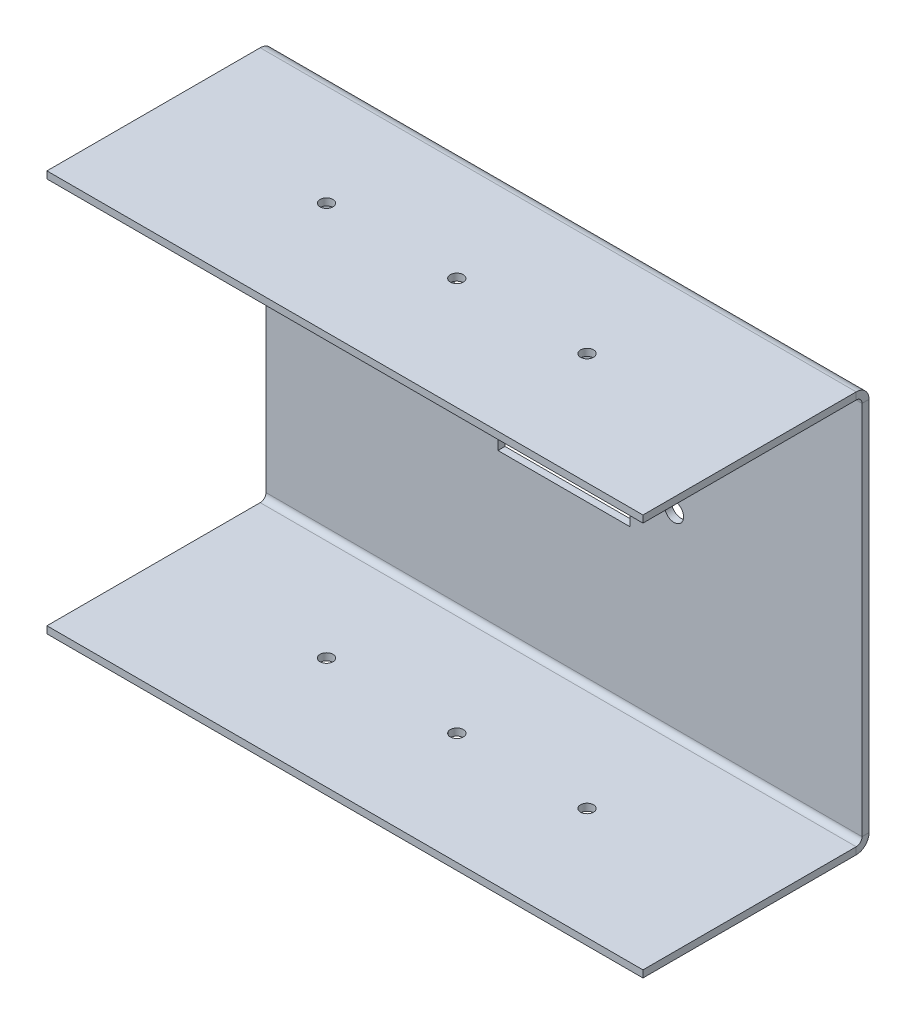
from build123d import *

# Parameters (mm, degrees)
SKETCH1_W                    = 135.38
SKETCH1_H                    = 188.37
SKETCH1_R                    = 1.4732
SKETCH1_R_2                  = 2.155
SKETCH1_W_2                  = 30
SKETCH1_H_2                  = 20
BASE_FLANGE1_DEPTH           = 1.6002
SKETCHED_BEND1_OUTLINE_W     = 135.38
SKETCHED_BEND1_OUTLINE_H     = 1.6002
SKETCHED_BEND1_DEPTH         = 137.314310973
SKETCHED_START               = 164.4432001
SKETCHED_BEND1_2_OUTLINE_W   = 135.38
SKETCHED_BEND1_2_OUTLINE_H   = 1.6002
SKETCHED_BEND1_2_DEPTH       = 23.9267999
SKETCHED_START_2             = 139.935207433
SKETCHED_BEND1_3_OUTLINE_W   = 135.38
SKETCHED_BEND1_3_OUTLINE_H   = 1.6002
SKETCHED_BEND1_3_DEPTH       = 21.561592467
SKETCHED_START_3             = 138.466703893
SKETCHED_BEND1_4_OUTLINE_W   = 135.38
SKETCHED_BEND1_4_OUTLINE_H   = 87.881185133
SKETCHED_BEND1_4_OUTLINE_R   = 2.155
SKETCHED_BEND1_4_OUTLINE_W_2 = 30
SKETCHED_BEND1_4_OUTLINE_H_2 = 20
SKETCHED_BEND1_4_DEPTH       = 0.14770354
SKETCHED_START_4             = 137.014207433
SKETCHED_BEND1_5_OUTLINE_W   = 135.38
SKETCHED_BEND1_5_OUTLINE_H   = 87.881185133
SKETCHED_BEND1_5_OUTLINE_R   = 2.155
SKETCHED_BEND1_5_OUTLINE_W_2 = 30
SKETCHED_BEND1_5_OUTLINE_H_2 = 20
SKETCHED_BEND1_5_DEPTH       = 2.921
SKETCHED_START_5             = 137.314310973
SKETCHED_BEND1_6_OUTLINE_W   = 135.38
SKETCHED_BEND1_6_OUTLINE_H   = 1.6002
SKETCHED_BEND1_6_DEPTH       = 27.128889127
SKETCHED_BEND1_7_DEPTH       = 135.38
SKETCHED_START_6             = 87
SKETCHED_BEND1_8_OUTLINE_R   = 1.4732
SKETCHED_BEND1_8_DEPTH       = 2.481385133


with BuildPart() as part:
    # Base-Flange1: sheet metal written as solids
    # Sketch1 → Base-Flange1 (new body)
    with BuildSketch(Plane(origin=(0, 0, 0), x_dir=(1, 0, 0), z_dir=(0, 1, 0))):
        with Locations((67.69, -94.185)):
            Rectangle(SKETCH1_W, SKETCH1_H)
        with Locations(Location((38.1, -25.4, 0), (0, 0, 270))):
            Circle(SKETCH1_R, mode=Mode.SUBTRACT)
        with Locations(Location((97.28, -25.4, 0), (0, 0, 270))):
            Circle(SKETCH1_R, mode=Mode.SUBTRACT)
        with Locations(Location((97.28, -162.97, 0), (0, 0, 90))):
            Circle(SKETCH1_R, mode=Mode.SUBTRACT)
        with Locations(Location((38.1, -162.97, 0), (0, 0, 90))):
            Circle(SKETCH1_R, mode=Mode.SUBTRACT)
        with Locations(Location((67.69, -25.4, 0), (0, 0, 270))):
            Circle(SKETCH1_R, mode=Mode.SUBTRACT)
        with Locations(Location((67.69, -162.97, 0), (0, 0, 270))):
            Circle(SKETCH1_R, mode=Mode.SUBTRACT)
        with Locations(Location((42.69, -94.185, 0), (0, 0, 270))):
            Circle(SKETCH1_R_2, mode=Mode.SUBTRACT)
        with Locations(Location((92.69, -94.185, 0), (0, 0, 270))):
            Circle(SKETCH1_R_2, mode=Mode.SUBTRACT)
        with Locations(Location((42.69, -74.185, 0), (0, 0, 270))):
            Circle(SKETCH1_R_2, mode=Mode.SUBTRACT)
        with Locations(Location((92.69, -74.185, 0), (0, 0, 270))):
            Circle(SKETCH1_R_2, mode=Mode.SUBTRACT)
        with Locations((67.69, -92.185)):
            Rectangle(SKETCH1_W_2, SKETCH1_H_2, mode=Mode.SUBTRACT)
    extrude(amount=-BASE_FLANGE1_DEPTH)

    # Sketched Bend1: read off the stored shape, not the designer's step
    # Sketched Bend1 outline → Sketched Bend1 (cut)
    with BuildSketch(Plane.XY):
        with Locations((67.69, -0.8001)):
            Rectangle(SKETCHED_BEND1_OUTLINE_W, SKETCHED_BEND1_OUTLINE_H)
    extrude(amount=SKETCHED_BEND1_DEPTH, mode=Mode.SUBTRACT)

    # Sketched Bend1 4 outline → Sketched Bend1 4 (add)
    with BuildSketch(Plane.XY.offset(SKETCHED_START_3)):
        with Locations((67.69, 43.940592567)):
            Rectangle(SKETCHED_BEND1_4_OUTLINE_W, SKETCHED_BEND1_4_OUTLINE_H)
        with Locations((42.69, 43.940592567)):
            Circle(SKETCHED_BEND1_4_OUTLINE_R, mode=Mode.SUBTRACT)
        with Locations((42.69, 63.940592567)):
            Circle(SKETCHED_BEND1_4_OUTLINE_R, mode=Mode.SUBTRACT)
        with Locations((67.69, 45.940592567)):
            Rectangle(SKETCHED_BEND1_4_OUTLINE_W_2, SKETCHED_BEND1_4_OUTLINE_H_2, mode=Mode.SUBTRACT)
        with Locations((92.69, 43.940592567)):
            Circle(SKETCHED_BEND1_4_OUTLINE_R, mode=Mode.SUBTRACT)
        with Locations((92.69, 63.940592567)):
            Circle(SKETCHED_BEND1_4_OUTLINE_R, mode=Mode.SUBTRACT)
    extrude(amount=SKETCHED_BEND1_4_DEPTH)



with BuildPart() as body_2:
    # Sketched Bend1 2 outline → Sketched Bend1 2 (new body)
    with BuildSketch(Plane.XY.offset(SKETCHED_START)):
        with Locations((67.69, 88.681285133)):
            Rectangle(SKETCHED_BEND1_2_OUTLINE_W, SKETCHED_BEND1_2_OUTLINE_H)
    extrude(amount=SKETCHED_BEND1_2_DEPTH)


with BuildPart() as body_3:
    # Sketched Bend1 3 outline → Sketched Bend1 3 (new body)
    with BuildSketch(Plane.XY.offset(SKETCHED_START_2)):
        with Locations((67.69, 88.681285133)):
            Rectangle(SKETCHED_BEND1_3_OUTLINE_W, SKETCHED_BEND1_3_OUTLINE_H)
    extrude(amount=SKETCHED_BEND1_3_DEPTH)


with BuildPart() as part_1:
    add(part.part)

    add(body_3.part)  # Sketched Bend1 5 merges body 3
    # Sketched Bend1 5 outline → Sketched Bend1 5 (add)
    with BuildSketch(Plane.XY.offset(SKETCHED_START_4)):
        with Locations((67.69, 43.940592567)):
            Rectangle(SKETCHED_BEND1_5_OUTLINE_W, SKETCHED_BEND1_5_OUTLINE_H)
        with Locations((42.69, 43.940592567)):
            Circle(SKETCHED_BEND1_5_OUTLINE_R, mode=Mode.SUBTRACT)
        with Locations((92.69, 43.940592567)):
            Circle(SKETCHED_BEND1_5_OUTLINE_R, mode=Mode.SUBTRACT)
        with Locations((42.69, 63.940592567)):
            Circle(SKETCHED_BEND1_5_OUTLINE_R, mode=Mode.SUBTRACT)
        with Locations((67.69, 45.940592567)):
            Rectangle(SKETCHED_BEND1_5_OUTLINE_W_2, SKETCHED_BEND1_5_OUTLINE_H_2, mode=Mode.SUBTRACT)
        with Locations((92.69, 63.940592567)):
            Circle(SKETCHED_BEND1_5_OUTLINE_R, mode=Mode.SUBTRACT)
    extrude(amount=SKETCHED_BEND1_5_DEPTH)


    add(body_2.part)  # Sketched Bend1 6 merges body 2
    # Sketched Bend1 6 outline → Sketched Bend1 6 (add)
    with BuildSketch(Plane.XY.offset(SKETCHED_START_5)):
        with Locations((67.69, 88.681285133)):
            Rectangle(SKETCHED_BEND1_6_OUTLINE_W, SKETCHED_BEND1_6_OUTLINE_H)
    extrude(amount=SKETCHED_BEND1_6_DEPTH)

    # Sketched Bend1 7 outline → Sketched Bend1 7 (cut)
    with BuildSketch(Plane.YZ):
        with BuildLine():
            ThreePointArc((89.481385133, 139.935207433), (88.62584404, 137.869748526), (86.560385133, 137.014207433))
            Line((86.560385133, 137.014207433), (87.881185133, 137.014207433))
            Line((87.881185133, 137.014207433), (87.881185133, 137.314310973))
            Line((87.881185133, 137.314310973), (89.481385133, 137.314310973))
            Line((89.481385133, 137.314310973), (89.481385133, 139.935207433))
        make_face()
        with BuildLine():
            Line((0, 137.014207433), (1.3208, 137.014207433))
            ThreePointArc((1.3208, 137.014207433), (-0.744658907, 137.869748526), (-1.6002, 139.935207433))
            Line((-1.6002, 139.935207433), (-1.6002, 137.314310973))
            Line((-1.6002, 137.314310973), (0, 137.314310973))
            Line((0, 137.314310973), (0, 137.014207433))
        make_face()
        with BuildLine():
            ThreePointArc((86.560385133, 138.614407433), (87.49433177, 139.001260796), (87.881185133, 139.935207433))
            Line((87.881185133, 139.935207433), (0, 139.935207433))
            ThreePointArc((0, 139.935207433), (0.386853363, 139.001260796), (1.3208, 138.614407433))
            Line((1.3208, 138.614407433), (86.560385133, 138.614407433))
        make_face()
    extrude(amount=SKETCHED_BEND1_7_DEPTH, mode=Mode.SUBTRACT)

    # Sketched Bend1 8 outline → Sketched Bend1 8 (cut)
    with BuildSketch(Plane(origin=(0, 0, 0), x_dir=(1, 0, 0), z_dir=(0, 1, 0)).offset(SKETCHED_START_6)):
        with Locations((67.69, -162.97)):
            Circle(SKETCHED_BEND1_8_OUTLINE_R)
        with Locations((97.28, -162.97)):
            Circle(SKETCHED_BEND1_8_OUTLINE_R)
        with Locations((38.1, -162.97)):
            Circle(SKETCHED_BEND1_8_OUTLINE_R)
    extrude(amount=SKETCHED_BEND1_8_DEPTH, mode=Mode.SUBTRACT)


solid = part_1.part
